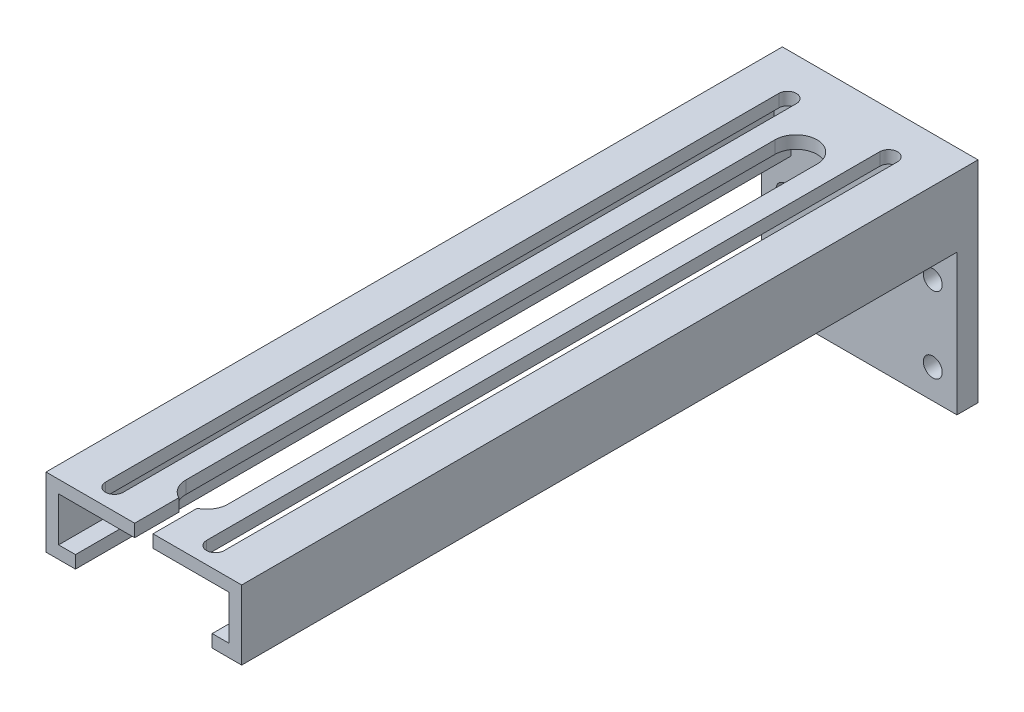
from build123d import *

# Parameters (mm, degrees)
ESQUISSE1_W              = 46.5
ESQUISSE1_H              = 50
BOSS_EXTRU_1_DEPTH       = 5
BOSS_EXTRU_2_DEPTH       = 170
D_GAGEMENT_M41_OUTLINE_R = 2.25
D_GAGEMENT_M41_DEPTH     = 5
ENL_V_MAT_EXTRU_3_REACH  = 185.482
ESQUISSE8_W              = 4.358898944
ESQUISSE8_H              = 10.5
ENL_V_MAT_EXTRU_4_DEPTH  = 5


# Read off the part's stored shape, not the designer's step: Dégagement M41
with BuildPart() as part:
    # Esquisse1 → Boss.-Extru.1 (new body)
    with BuildSketch(Plane.XY):
        Rectangle(ESQUISSE1_W, ESQUISSE1_H)
    extrude(amount=BOSS_EXTRU_1_DEPTH)

    # Esquisse2 → Boss.-Extru.2 (add)
    with BuildSketch(Plane.XY.offset(5)):
        Polygon((-23.25, 25), (23.25, 25), (23.25, 8.5), (16.25, 8.5), (16.25, 11.5), (20.25, 11.5), (20.25, 22), (-20.25, 22), (-20.25, 11.5), (-16.25, 11.5), (-16.25, 8.5), (-23.25, 8.5), align=None)
    extrude(amount=BOSS_EXTRU_2_DEPTH)

    # Dégagement M41 outline → Dégagement M41 (cut)
    with BuildSketch(Plane.XY):
        with Locations((17.5, -18)):
            Circle(D_GAGEMENT_M41_OUTLINE_R)
        with Locations((-17.5, 0)):
            Circle(D_GAGEMENT_M41_OUTLINE_R)
        with Locations((17.5, 0)):
            Circle(D_GAGEMENT_M41_OUTLINE_R)
        with Locations((-17.5, -18)):
            Circle(D_GAGEMENT_M41_OUTLINE_R)
    extrude(amount=D_GAGEMENT_M41_DEPTH, mode=Mode.SUBTRACT)

    # Esquisse5 → Enlèv. mat.-Extru.3 (cut, up to next)
    with BuildSketch(Plane(origin=(0, 25, 0), x_dir=(1, 0, 0), z_dir=(0, 1, 0)), mode=Mode.PRIVATE) as enl_v_mat_extru_3_sk1:
        with BuildLine():
            Line((14.1, -10), (14.1, -170))
            ThreePointArc((14.1, -170), (12, -172.1), (9.9, -170))
            Line((9.9, -170), (9.9, -10))
            ThreePointArc((9.9, -10), (12, -7.9), (14.1, -10))
        make_face()
    enl_v_mat_extru_3_tool1 = extrude(enl_v_mat_extru_3_sk1.sketch, amount=-ENL_V_MAT_EXTRU_3_REACH, mode=Mode.PRIVATE) & part.part
    # Esquisse5 → Enlèv. mat.-Extru.3 (cut, up to next)
    with BuildSketch(Plane(origin=(0, 25, 0), x_dir=(1, 0, 0), z_dir=(0, 1, 0)), mode=Mode.PRIVATE) as enl_v_mat_extru_3_sk2:
        with BuildLine():
            Line((-9.9, -10), (-9.9, -170))
            ThreePointArc((-9.9, -170), (-12, -172.1), (-14.1, -170))
            Line((-14.1, -170), (-14.1, -10))
            ThreePointArc((-14.1, -10), (-12, -7.9), (-9.9, -10))
        make_face()
    enl_v_mat_extru_3_tool2 = extrude(enl_v_mat_extru_3_sk2.sketch, amount=-ENL_V_MAT_EXTRU_3_REACH, mode=Mode.PRIVATE) & part.part
    # Esquisse5 → Enlèv. mat.-Extru.3 (cut, up to next)
    with BuildSketch(Plane(origin=(0, 25, 0), x_dir=(1, 0, 0), z_dir=(0, 1, 0)), mode=Mode.PRIVATE) as enl_v_mat_extru_3_sk3:
        with BuildLine():
            Line((-5, -160), (-5, -20))
            ThreePointArc((-5, -20), (0, -15), (5, -20))
            Line((5, -20), (5, -160))
            ThreePointArc((5, -160), (0, -165), (-5, -160))
        make_face()
    enl_v_mat_extru_3_tool3 = extrude(enl_v_mat_extru_3_sk3.sketch, amount=-ENL_V_MAT_EXTRU_3_REACH, mode=Mode.PRIVATE) & part.part
    add(enl_v_mat_extru_3_tool1.solids().sort_by_distance((12, 25, 90))[0], mode=Mode.SUBTRACT)
    add(enl_v_mat_extru_3_tool2.solids().sort_by_distance((-12, 25, 90))[0], mode=Mode.SUBTRACT)
    add(enl_v_mat_extru_3_tool3.solids().sort_by_distance((0, 25, 90))[0], mode=Mode.SUBTRACT)

    # Esquisse8 → Enlèv. mat.-Extru.4 (cut)
    with BuildSketch(Plane(origin=(0, 25, 0), x_dir=(1, 0, 0), z_dir=(0, 1, 0))):
        with Locations((0, -169.75)):
            Rectangle(ESQUISSE8_W, ESQUISSE8_H)
    extrude(amount=-ENL_V_MAT_EXTRU_4_DEPTH, mode=Mode.SUBTRACT)


solid = part.part
